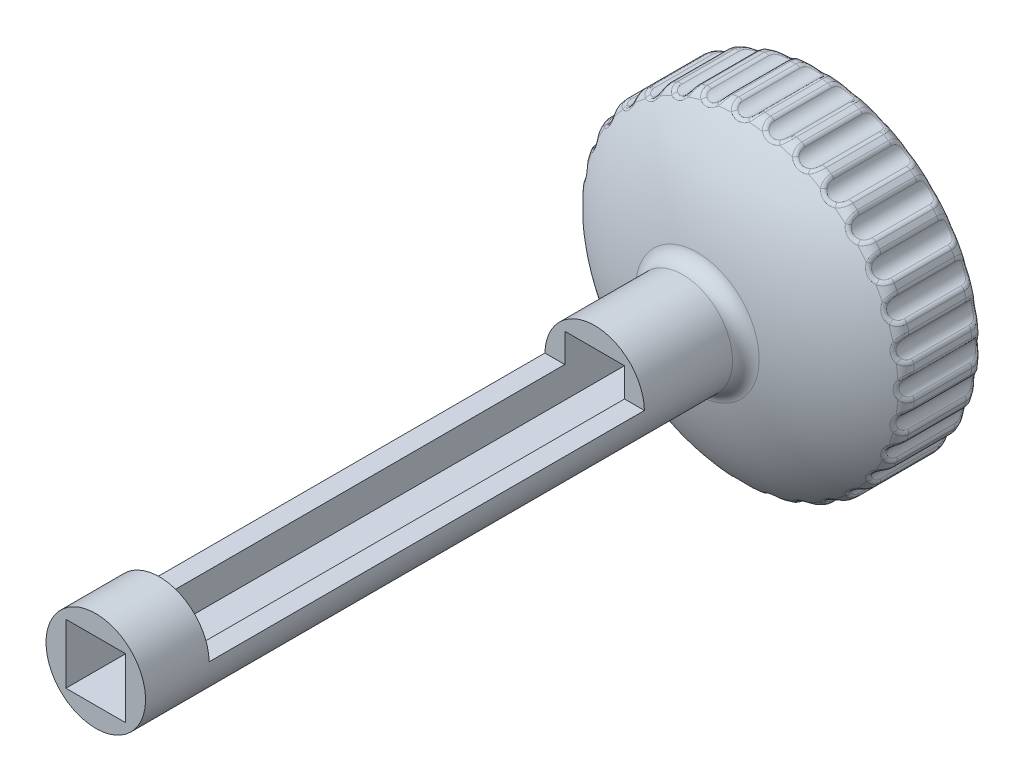
from build123d import *

# Parameters (mm, degrees)
SKETCH2_R           = 1
BOSS_EXTRUDE1_DEPTH = 15
FILLET1_R           = 0.3
FILLET2_R           = 0.3
FILLET3_R           = 0.3
FILLET4_R           = 0.3
SKETCH3_R           = 0.25
CUT_EXTRUDE1_DEPTH  = 10
FILLET5_R           = 0.1
SKETCH4_W           = 1.2
SKETCH4_H           = 1.2
CUT_EXTRUDE4_DEPTH  = 17.08008218
SKETCH5_W           = 4.69371587
SKETCH5_H           = 8.745366833
CUT_EXTRUDE5_DEPTH  = 1.5
SKETCH6_R           = 2
CUT_EXTRUDE6_DEPTH  = 0.2
FILLET6_R           = 0.05


with BuildPart() as part:
    # Sketch1 → Revolve1 (revolve)
    with BuildSketch(Plane(origin=(0, 0, 0), x_dir=(0, 0, -1), z_dir=(1, 0, 0)), mode=Mode.PRIVATE) as revolve1_sk:
        with BuildLine():
            Line((2.110765163, -1.520945792), (-0.923273819, -1.520945792))
            add(Edge.make_bspline(
                [(-0.923273819, -1.520945792), (-0.923273819, -0.202908465), (-0.527632483, 1.007714866), (0.154246118, 1.754679197)],
                knots=[0, 0, 0, 0, 0.621385643, 0.621385643, 0.621385643, 0.621385643], degree=3))
            Line((0.154246118, 1.754679197), (1.654246118, 1.754679197))
            Line((1.654246118, 1.754679197), (2.110765163, 0.479054208))
            Line((2.110765163, 0.479054208), (2.110765163, -1.520945792))
        make_face()
    revolve(revolve1_sk.sketch.rotate(Axis((0, -1.520945792, -2.110765163), (0, 0, 1)), 90), axis=Axis((0, -1.520945792, -2.110765163), (0, 0, 1)))

    # Sketch2 → Boss-Extrude1 (add)
    with BuildSketch(Plane(origin=(0, 0, -2.110765163), x_dir=(-1, 0, 0), z_dir=(0, 0, -1))):
        with Locations((0, -1.520945792)):
            Circle(SKETCH2_R)
    extrude(amount=-BOSS_EXTRUDE1_DEPTH)

    # Fillet1
    fillet1_edges = [part.edges().sort_by_distance(p)[0] for p in [
        (1, -1.520945793, 0.844964518),
    ]]
    fillet(fillet1_edges, radius=FILLET1_R)

    # Fillet2
    fillet2_edges = [part.edges().sort_by_distance(p)[0] for p in [
        (3.275624989, -1.520945792, -0.154246118),
    ]]
    fillet(fillet2_edges, radius=FILLET2_R)

    # Fillet3
    fillet3_edges = [part.edges().sort_by_distance(p)[0] for p in [
        (3.275624989, -1.520945792, -1.654246118),
    ]]
    fillet(fillet3_edges, radius=FILLET3_R)

    # Fillet4
    fillet4_edges = [part.edges().sort_by_distance(p)[0] for p in [
        (2, -1.520945792, -2.110765163),
    ]]
    fillet(fillet4_edges, radius=FILLET4_R)

    # Sketch3 → Cut-Extrude1 (cut)
    with BuildSketch(Plane(origin=(0, 0, -2.110765163), x_dir=(-1, 0, 0), z_dir=(0, 0, -1))):
        with Locations((0, 1.881998503)):
            Circle(SKETCH3_R)
        with Locations((0.663881498, 1.816611882)):
            Circle(SKETCH3_R)
        with Locations((1.302250403, 1.622964792)):
            Circle(SKETCH3_R)
        with Locations((1.890574555, 1.308498981)):
            Circle(SKETCH3_R)
        with Locations((2.406244987, 0.885299195)):
            Circle(SKETCH3_R)
        with Locations((2.829444774, 0.369628763)):
            Circle(SKETCH3_R)
        with Locations((3.143910585, -0.218695389)):
            Circle(SKETCH3_R)
        with Locations((3.337557675, -0.857064294)):
            Circle(SKETCH3_R)
        with Locations((3.402944295, -1.520945792)):
            Circle(SKETCH3_R)
        with Locations((3.337557675, -2.184827291)):
            Circle(SKETCH3_R)
        with Locations((3.143910585, -2.823196195)):
            Circle(SKETCH3_R)
        with Locations((2.829444774, -3.411520347)):
            Circle(SKETCH3_R)
        with Locations((2.406244987, -3.92719078)):
            Circle(SKETCH3_R)
        with Locations((1.890574555, -4.350390566)):
            Circle(SKETCH3_R)
        with Locations((1.302250403, -4.664856377)):
            Circle(SKETCH3_R)
        with Locations((0.663881498, -4.858503467)):
            Circle(SKETCH3_R)
        with Locations((0, -4.923890088)):
            Circle(SKETCH3_R)
        with Locations((-0.663881498, -4.858503467)):
            Circle(SKETCH3_R)
        with Locations((-1.302250403, -4.664856377)):
            Circle(SKETCH3_R)
        with Locations((-1.890574555, -4.350390566)):
            Circle(SKETCH3_R)
        with Locations((-2.406244987, -3.92719078)):
            Circle(SKETCH3_R)
        with Locations((-2.829444774, -3.411520347)):
            Circle(SKETCH3_R)
        with Locations((-3.143910585, -2.823196195)):
            Circle(SKETCH3_R)
        with Locations((-3.337557675, -2.184827291)):
            Circle(SKETCH3_R)
        with Locations((-3.402944295, -1.520945792)):
            Circle(SKETCH3_R)
        with Locations((-3.337557675, -0.857064294)):
            Circle(SKETCH3_R)
        with Locations((-3.143910585, -0.218695389)):
            Circle(SKETCH3_R)
        with Locations((-2.829444774, 0.369628763)):
            Circle(SKETCH3_R)
        with Locations((-2.406244987, 0.885299195)):
            Circle(SKETCH3_R)
        with Locations((-1.890574555, 1.308498981)):
            Circle(SKETCH3_R)
        with Locations((-1.302250403, 1.622964792)):
            Circle(SKETCH3_R)
        with Locations((-0.663881498, 1.816611882)):
            Circle(SKETCH3_R)
    extrude(amount=-CUT_EXTRUDE1_DEPTH, mode=Mode.SUBTRACT)

    # Fillet5
    fillet5_edges = [part.edges().sort_by_distance(p)[0] for p in [
        (-2.91293728, -0.314358026, -1.684959877),
        (-3.057131975, -0.453151083, -0.145826265),
        (-2.912934592, -0.314351496, -0.048207387),
        (-2.91677107, -0.114255743, -0.145826284),
        (-2.939261475, -0.075103113, -0.866898158),
        (-3.100736883, -0.464939235, -0.866898158),
        (-3.092361714, -0.905838661, -1.684948725),
        (-3.206695752, -1.070078745, -0.145817424),
        (-3.092361673, -0.905838474, -0.048207387),
        (-3.135137808, -0.710346209, -0.145817494),
        (-3.164854303, -0.676306042, -0.866898158),
        (-3.247173753, -1.090153862, -0.866898158),
        (-3.214332084, -1.35685608, -1.619047493),
        (-3.233058295, -1.704354479, -0.145830429),
        (-3.156312554, -1.561845469, -0.051187589),
        (-3.233058295, -1.337537106, -0.145830429),
        (-3.268823556, -1.309968004, -0.866898158),
        (-3.268823556, -1.731923581, -0.866898158),
        (-3.092361714, -2.136052927, -1.684948725),
        (-3.135137808, -2.331545376, -0.145817494),
        (-3.092361673, -2.136053111, -0.048207387),
        (-3.206695752, -1.97181284, -0.145817424),
        (-3.247173753, -1.951737723, -0.866898158),
        (-3.164854303, -2.365585542, -0.866898158),
        (-2.912937279, -2.72753356, -1.684959877),
        (-2.91677107, -2.927635842, -0.145826284),
        (-2.912934592, -2.727540088, -0.048207387),
        (-3.057131975, -2.588740502, -0.145826265),
        (-3.100736883, -2.57695235, -0.866898158),
        (-2.939261475, -2.966788472, -0.866898158),
        (-2.621576159, -3.272629603, -1.684971729),
        (-2.586299218, -3.469660161, -0.145835232),
        (-2.621577371, -3.272627789, -0.048207387),
        (-2.79010691, -3.164634682, -0.145835276),
        (-2.835140434, -3.161585237, -0.866898158),
        (-2.600714476, -3.512428478, -0.866898158),
        (-2.229470534, -3.750411842, -1.684969487),
        (-2.156428517, -3.936768377, -0.145833423),
        (-2.229468292, -3.750414084, -0.048207387),
        (-2.415828931, -3.677374553, -0.145833431),
        (-2.460591128, -3.68316927, -0.866898158),
        (-2.162223478, -3.981536921, -0.866898158),
        (-1.75168386, -4.142521939, -1.684963535),
        (-1.643691705, -4.311035041, -0.14582893),
        (-1.751681997, -4.142523163, -0.048207387),
        (-1.948697109, -4.107240884, -0.145828911),
        (-1.991482685, -4.121660268, -0.866898158),
        (-1.640639445, -4.356086227, -0.866898158),
        (-1.206579615, -4.433886455, -1.684961588),
        (-1.067790138, -4.57809012, -0.145827495),
        (-1.206579545, -4.433886494, -0.048207387),
        (-1.406685989, -4.437714995, -0.145827479),
        (-1.445842679, -4.460207267, -0.866898158),
        (-1.056006557, -4.621682676, -0.866898158),
        (-0.615108835, -4.613307144, -1.684961938),
        (-0.450853199, -4.727664089, -0.14582779),
        (-0.615108918, -4.613307147, -0.048207387),
        (-0.810623799, -4.656101154, -0.145827786),
        (-0.84463975, -4.685800096, -0.866898158),
        (-0.43079193, -4.768119545, -0.866898158),
        (-5.01e-07, -4.673890079, -1.68496142),
        (0.183408353, -4.754003728, -0.145827395),
        (0, -4.673890088, -0.048207387),
        (-0.183409047, -4.754004477, -0.145827398),
        (-0.210977789, -4.789769349, -0.866898158),
        (0.210977789, -4.789769349, -0.866898158),
        (0.615109124, -4.613307106, -1.684960803),
        (0.81062211, -4.65609993, -0.1458269),
        (0.615108918, -4.613307147, -0.048207387),
        (0.450854573, -4.727661852, -0.14582691),
        (0.43079193, -4.768119545, -0.866898158),
        (0.84463975, -4.685800096, -0.866898158),
        (1.206581367, -4.433885739, -1.684962832),
        (1.406690416, -4.43771703, -0.145828401),
        (1.206579545, -4.433886494, -0.048207387),
        (1.067789748, -4.578091175, -0.145828416),
        (1.056006557, -4.621682676, -0.866898158),
        (1.445842679, -4.460207267, -0.866898158),
        (1.775199432, -4.128605714, -1.683778709),
        (1.948706684, -4.107243173, -0.145832052),
        (1.751681997, -4.142523163, -0.048207387),
        (1.646991483, -4.294111918, -0.124604629),
        (1.640639445, -4.356086227, -0.866898158),
        (1.991482685, -4.121660268, -0.866898158),
        (2.297557277, -3.702053087, -1.673215214),
        (2.41583218, -3.677374678, -0.145835167),
        (2.229468292, -3.750414084, -0.048207387),
        (2.16159413, -3.875751898, -0.087794052),
        (2.162223478, -3.981536921, -0.866898158),
        (2.460591128, -3.68316927, -0.866898158),
        (2.998432575, -2.619883265, -1.649234685),
        (3.057147839, -2.588734631, -0.145830055),
        (2.912940701, -2.727525337, -0.048207387),
        (2.918908803, -2.932164991, -0.153109396),
        (2.939261475, -2.966788472, -0.866898158),
        (3.100736883, -2.57695235, -0.866898158),
        (3.170210862, -1.999098875, -1.635047745),
        (3.2067069, -1.971805992, -0.145824422),
        (3.092360653, -2.136057697, -0.048207317),
        (3.135151376, -2.331564094, -0.145824402),
        (3.164854303, -2.365585542, -0.866898158),
        (3.247173753, -1.951737723, -0.866898158),
        (3.2143282, -1.68503104, -1.619040792),
        (3.233046126, -1.337548379, -0.145821899),
        (3.152944259, -1.520945791, -0.048207362),
        (3.233046126, -1.704343206, -0.145821899),
        (3.268823556, -1.731923581, -0.866898158),
        (3.268823556, -1.309968004, -0.866898158),
        (3.170210868, -1.042792717, -1.63504774),
        (3.135151376, -0.710327491, -0.145824402),
        (3.092360725, -0.905833878, -0.048207362),
        (3.2067069, -1.070085593, -0.145824422),
        (3.247173753, -1.090153862, -0.866898158),
        (3.164854303, -0.676306042, -0.866898158),
        (2.998432574, -0.42200832, -1.649234686),
        (2.918908803, -0.109726593, -0.153109396),
        (2.912940701, -0.314366248, -0.048207387),
        (3.057147839, -0.453156953, -0.145830055),
        (3.100736883, -0.464939235, -0.866898158),
        (2.939261475, -0.075103113, -0.866898158),
        (2.704753442, 0.152944496, -1.661836431),
        (2.591325602, 0.445781632, -0.176863559),
        (2.621577371, 0.230736204, -0.048207387),
        (2.790106278, 0.122743198, -0.145834643),
        (2.835140434, 0.119693652, -0.866898158),
        (2.600714476, 0.470536893, -0.866898158),
        (2.297557291, 0.660161494, -1.673215211),
        (2.15960712, 0.926161934, -0.207308979),
        (2.229468292, 0.708522499, -0.048207387),
        (2.41583218, 0.635483093, -0.145835167),
        (2.460591128, 0.641277685, -0.866898158),
        (2.162223478, 0.939645336, -0.866898158),
        (1.775199354, 1.086714034, -1.683778808),
        (1.646991483, 1.252220333, -0.124604629),
        (1.751681997, 1.100631578, -0.048207387),
        (1.948706684, 1.065351588, -0.145832052),
        (1.991482685, 1.079768683, -0.866898158),
        (1.640639445, 1.314194642, -0.866898158),
        (-5.19e-07, 1.631998494, -1.68496142),
        (1.206581351, 1.391994161, -1.684962832),
        (1.067789748, 1.53619959, -0.145828416),
        (1.206579545, 1.391994909, -0.048207387),
        (1.406690416, 1.395825446, -0.145828401),
        (1.445842679, 1.418315682, -0.866898158),
        (1.056006557, 1.579791091, -0.866898158),
        (0.615109097, 1.571415527, -1.684960803),
        (0.450854573, 1.685770267, -0.14582691),
        (0.615108918, 1.571415562, -0.048207387),
        (0.81062211, 1.614208345, -0.1458269),
        (0.84463975, 1.643908511, -0.866898158),
        (0.43079193, 1.72622796, -0.866898158),
        (-0.183409047, 1.712112892, -0.145827398),
        (0, 1.631998503, -0.048207387),
        (0.183408353, 1.712112143, -0.145827395),
        (0.210977789, 1.747877764, -0.866898158),
        (-0.210977789, 1.747877764, -0.866898158),
        (2.704753448, -3.194836075, -1.661836429),
        (2.790106278, -3.164634783, -0.145834643),
        (2.621577371, -3.272627789, -0.048207387),
        (2.591325602, -3.487673217, -0.176863559),
        (2.600714476, -3.512428478, -0.866898158),
        (2.835140434, -3.161585237, -0.866898158),
        (-0.615108847, 1.571415557, -1.684961938),
        (-0.810623799, 1.614209569, -0.145827786),
        (-0.615108918, 1.571415562, -0.048207387),
        (-0.450853199, 1.685772505, -0.14582779),
        (-0.43079193, 1.72622796, -0.866898158),
        (-0.84463975, 1.643908511, -0.866898158),
        (-1.20657963, 1.391994864, -1.684961588),
        (-1.406685989, 1.39582341, -0.145827479),
        (-1.206579545, 1.391994909, -0.048207387),
        (-1.067790138, 1.536198535, -0.145827495),
        (-1.056006557, 1.579791091, -0.866898158),
        (-1.445842679, 1.418315682, -0.866898158),
        (-1.751683877, 1.100630344, -1.684963535),
        (-1.948697109, 1.065349299, -0.145828911),
        (-1.751681997, 1.100631578, -0.048207387),
        (-1.643691705, 1.269143456, -0.14582893),
        (-1.640639445, 1.314194642, -0.866898158),
        (-1.991482685, 1.079768683, -0.866898158),
        (-2.229470542, 0.70852025, -1.684969487),
        (-2.415828931, 0.635482968, -0.145833431),
        (-2.229468292, 0.708522499, -0.048207387),
        (-2.156428517, 0.894876792, -0.145833423),
        (-2.162223478, 0.939645336, -0.866898158),
        (-2.460591128, 0.641277685, -0.866898158),
        (-2.621576164, 0.23073801, -1.684971729),
        (-2.79010691, 0.122743098, -0.145835276),
        (-2.621577371, 0.230736204, -0.048207387),
        (-2.586299218, 0.427768576, -0.145835232),
        (-2.600714476, 0.470536893, -0.866898158),
        (-2.835140434, 0.119693652, -0.866898158),
    ]]
    fillet(fillet5_edges, radius=FILLET5_R)

    # Sketch4 → Cut-Extrude4 (cut, through all)
    with BuildSketch(Plane(origin=(0, 0, -2.110765163), x_dir=(-1, 0, 0), z_dir=(0, 0, -1))):
        with Locations((0, -1.520945792)):
            Rectangle(SKETCH4_W, SKETCH4_H)
    extrude(amount=-CUT_EXTRUDE4_DEPTH, mode=Mode.SUBTRACT)

    # Sketch5 → Cut-Extrude5 (cut)
    with BuildSketch(Plane(origin=(0, 0, 0), x_dir=(1, 0, 0), z_dir=(0, 1, 0))):
        with Locations((0.066420508, -7.237938966)):
            Rectangle(SKETCH5_W, SKETCH5_H)
    extrude(amount=-CUT_EXTRUDE5_DEPTH, mode=Mode.SUBTRACT)

    # Sketch6 → Cut-Extrude6 (cut)
    with BuildSketch(Plane(origin=(0, 0, -2.110765163), x_dir=(-1, 0, 0), z_dir=(0, 0, -1))):
        with Locations((0, -1.520945792)):
            Circle(SKETCH6_R)
    extrude(amount=-CUT_EXTRUDE6_DEPTH, mode=Mode.SUBTRACT)

    # Fillet6
    fillet6_edges = [part.edges().sort_by_distance(p)[0] for p in [
        (2, -1.520945792, -2.106212691),
    ]]
    fillet(fillet6_edges, radius=FILLET6_R)


solid = part.part
